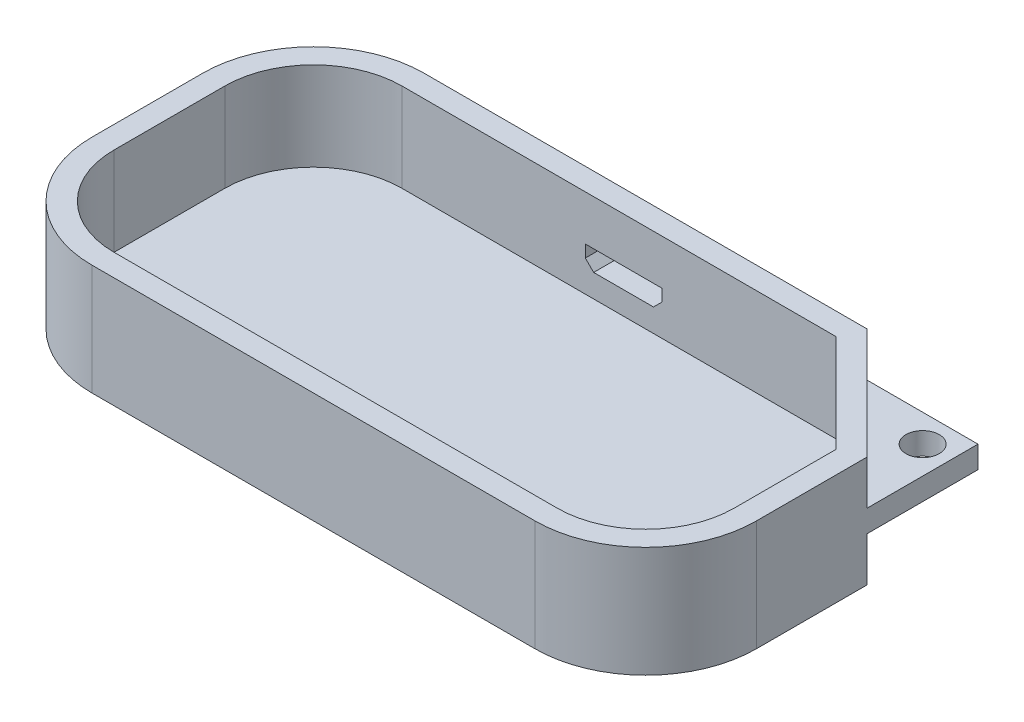
from build123d import *

# Parameters (mm, degrees)
SKETCH1_W           = 60
SKETCH1_H           = 30
BOSS_EXTRUDE1_DEPTH = 10
FILLET1_R           = 10
FILLET3_R           = 10
FILLET4_R           = 10
CUT_EXTRUDE1_DEPTH  = 4
CUT_EXTRUDE2_DEPTH  = 4
SKETCH8_R           = 1.5
CUT_EXTRUDE3_DEPTH  = 4
SHELL5_START        = 2
SHELL5_DEPTH        = 8
CUT_EXTRUDE4_DEPTH  = 2
SKETCH11_W          = 6.86286456
SKETCH11_H          = 3.5
BOSS_EXTRUDE2_DEPTH = 1
CUT_EXTRUDE5_DEPTH  = 0.1


# Read off the part's stored shape, not the designer's step: Shell5
with BuildPart() as part:
    # Sketch1 → Boss-Extrude1 (new body)
    with BuildSketch(Plane(origin=(0, 0, 0), x_dir=(1, 0, 0), z_dir=(0, 1, 0))):
        with Locations((-2.582747066, 7.592753862)):
            Rectangle(SKETCH1_W, SKETCH1_H)
    extrude(amount=BOSS_EXTRUDE1_DEPTH)

    # Fillet1
    fillet1_edges = [part.edges().sort_by_distance(p)[0] for p in [
        (27.417252934, 5, 7.407246138),
    ]]
    fillet(fillet1_edges, radius=FILLET1_R)

    # Fillet3
    fillet3_edges = [part.edges().sort_by_distance(p)[0] for p in [
        (-32.582747066, 5, 7.407246138),
    ]]
    fillet(fillet3_edges, radius=FILLET3_R)

    # Fillet4
    fillet4_edges = [part.edges().sort_by_distance(p)[0] for p in [
        (-32.582747066, 5, -22.592753862),
    ]]
    fillet(fillet4_edges, radius=FILLET4_R)

    # Sketch6 → Cut-Extrude1 (cut)
    with BuildSketch(Plane(origin=(0, 10, 0), x_dir=(1, 0, 0), z_dir=(0, 1, 0))):
        Polygon((17.417252934, 22.592753862), (27.417252934, 12.592753862), (27.417252934, 22.592753862), align=None)
    extrude(amount=-CUT_EXTRUDE1_DEPTH, mode=Mode.SUBTRACT)

    # Sketch7 → Cut-Extrude2 (cut)
    with BuildSketch(Plane.XZ):
        Polygon((27.417252934, -22.592753862), (27.417252934, -12.592753862), (17.417252934, -22.592753862), align=None)
    extrude(amount=-CUT_EXTRUDE2_DEPTH, mode=Mode.SUBTRACT)

    # Sketch8 → Cut-Extrude3 (cut)
    with BuildSketch(Plane(origin=(0, 6, 0), x_dir=(1, 0, 0), z_dir=(0, 1, 0))):
        with Locations(Location((24.917252934, 20.092753862, 0), (0, 0, 270))):
            Circle(SKETCH8_R)
    extrude(amount=-CUT_EXTRUDE3_DEPTH, mode=Mode.SUBTRACT)

    # Shell5 outline → Shell5 (cut)
    with BuildSketch(Plane(origin=(0, 0, 0), x_dir=(1, 0, 0), z_dir=(0, 1, 0)).offset(SHELL5_START)):
        with BuildLine():
            Line((25.417252934, 2.592753862), (25.417252934, 11.764326737))
            Line((25.417252934, 11.764326737), (16.588825809, 20.592753862))
            Line((16.588825809, 20.592753862), (-22.582747066, 20.592753862))
            ThreePointArc((-22.582747066, 20.592753862), (-28.239601315, 18.249608111), (-30.582747066, 12.592753862))
            Line((-30.582747066, 12.592753862), (-30.582747066, 2.592753862))
            ThreePointArc((-30.582747066, 2.592753862), (-28.239601315, -3.064100388), (-22.582747066, -5.407246138))
            Line((-22.582747066, -5.407246138), (17.417252934, -5.407246138))
            ThreePointArc((17.417252934, -5.407246138), (23.074107184, -3.064100387), (25.417252934, 2.592753862))
        make_face()
    extrude(amount=SHELL5_DEPTH, mode=Mode.SUBTRACT)

    # Sketch10 → Cut-Extrude4 (cut)
    with BuildSketch(Plane(origin=(0, 0, -22.592753862), x_dir=(-1, 0, 0), z_dir=(0, 0, -1))):
        Polygon((2.582747066, 5.925), (6.032747066, 5.925), (6.032747066, 4.825), (5.282747066, 4.075), (2.582747066, 4.075), (-0.117252934, 4.075), (-0.867252934, 4.825), (-0.867252934, 5.925), align=None)
    extrude(amount=-CUT_EXTRUDE4_DEPTH, mode=Mode.SUBTRACT)

    # Sketch11 → Boss-Extrude2 (add)
    with BuildSketch(Plane(origin=(0, 0, -22.592753862), x_dir=(-1, 0, 0), z_dir=(0, 0, -1))):
        with Locations((12.582747066, 5)):
            Rectangle(SKETCH11_W, SKETCH11_H)
    extrude(amount=BOSS_EXTRUDE2_DEPTH)

    # Sketch12 → Cut-Extrude5 (cut)
    with BuildSketch(Plane(origin=(0, 0, -23.592753862), x_dir=(-1, 0, 0), z_dir=(0, 0, -1))):
        Polygon((12.582747066, 5), (12.735825542, 5), (12.735825542, 6.297110067), (12.428698836, 6.297110067), (12.428698836, 5), align=None)
        with BuildLine():
            Line((12.111519237, 5.882859707), (12.204075045, 5.709453579))
            ThreePointArc((12.204075045, 5.709453579), (12.582747066, 4.195812907), (12.961419087, 5.709453579))
            Line((12.961419087, 5.709453579), (13.053974895, 5.882859707))
            ThreePointArc((13.053974895, 5.882859707), (12.582747066, 3.999251816), (12.111519237, 5.882859707))
        make_face()
    extrude(amount=-CUT_EXTRUDE5_DEPTH, mode=Mode.SUBTRACT)


solid = part.part
